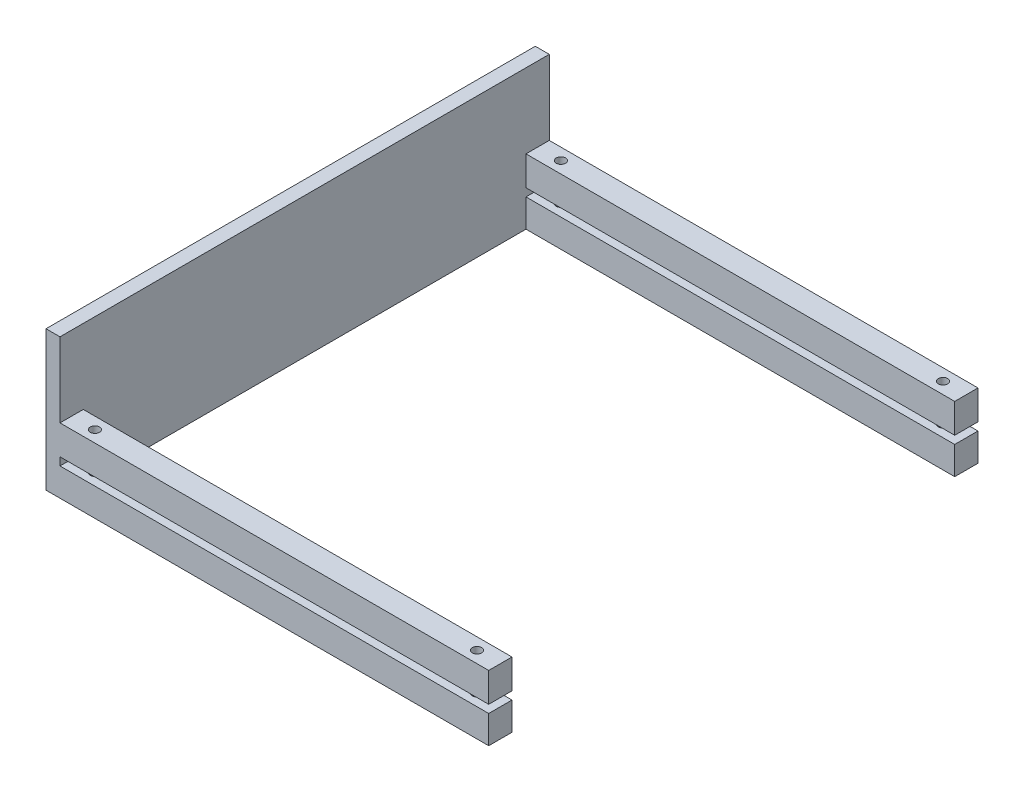
from build123d import *

# Parameters (mm, degrees)
BOSS_EXTRUDE1_DEPTH = 105
CUT_EXTRUDE1_DEPTH  = 141.516902898
SKETCH3_R           = 1
CUT_EXTRUDE2_DEPTH  = 141.516902898


with BuildPart() as part:
    # Sketch1 → Boss-Extrude1 (new body)
    with BuildSketch(Plane.XY):
        Polygon((0, 16), (0, 0), (92, 0), (92, -14), (-3, -14), (-3, 16), align=None)
    extrude(amount=-BOSS_EXTRUDE1_DEPTH)

    # Sketch2 → Cut-Extrude1 (cut, through all)
    with BuildSketch(Plane(origin=(0, 0, 0), x_dir=(0, 0, -1), z_dir=(1, 0, 0))):
        Polygon((0, -6.3), (5, -6.3), (5, 0), (100, 0), (100, -6.3), (105, -6.3), (105, -8), (100, -8), (100, -14), (5, -14), (5, -8), (0, -8), align=None)
    extrude(amount=CUT_EXTRUDE1_DEPTH, mode=Mode.SUBTRACT)

    # Sketch3 → Cut-Extrude2 (cut, through all)
    with BuildSketch(Plane(origin=(0, 0, 0), x_dir=(1, 0, 0), z_dir=(0, 1, 0))):
        with Locations((87, 102.5)):
            Circle(SKETCH3_R)
        with Locations((5, 102.5)):
            Circle(SKETCH3_R)
        with Locations((5, 2.5)):
            Circle(SKETCH3_R)
        with Locations((87, 2.5)):
            Circle(SKETCH3_R)
    extrude(amount=-CUT_EXTRUDE2_DEPTH, mode=Mode.SUBTRACT)


solid = part.part
